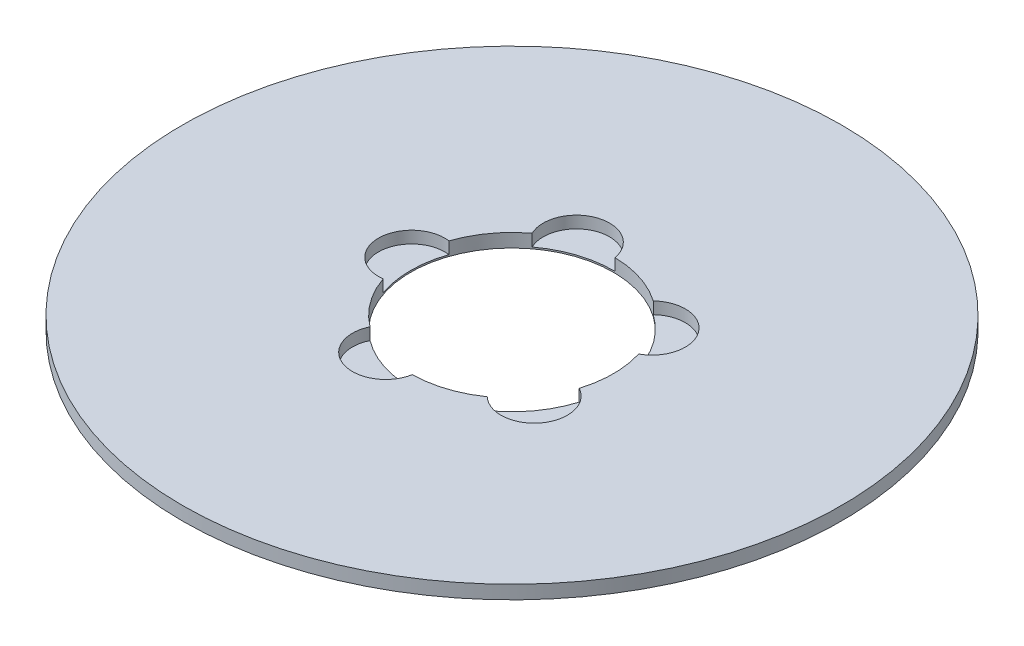
from build123d import *

# Parameters (mm, degrees)
SKETCH1_R           = 97.5
BOSS_EXTRUDE1_DEPTH = 4
SKETCH2_R           = 30
CUT_EXTRUDE1_DEPTH  = 138.943829148
SKETCH3_R           = 9.823399276
CUT_EXTRUDE2_DEPTH  = 3.531855197
CIRPATTERN1_COUNT   = 5


with BuildPart() as part:
    # Sketch1 → Boss-Extrude1 (new body)
    with BuildSketch(Plane(origin=(0, 0, 0), x_dir=(1, 0, 0), z_dir=(0, 1, 0))):
        Circle(SKETCH1_R)
    extrude(amount=BOSS_EXTRUDE1_DEPTH)

    # Sketch2 → Cut-Extrude1 (cut, through all)
    with BuildSketch(Plane(origin=(0, 0, 0), x_dir=(1, 0, 0), z_dir=(0, 1, 0))):
        Circle(SKETCH2_R)
    extrude(amount=CUT_EXTRUDE1_DEPTH, mode=Mode.SUBTRACT)

    # Sketch3 → Cut-Extrude2 (cut)
    with BuildSketch(Plane(origin=(0, 4, 0), x_dir=(1, 0, 0), z_dir=(0, 1, 0))):
        with Locations((-29.675737108, 0)):
            Circle(SKETCH3_R)
    cut_extrude2 = extrude(amount=-CUT_EXTRUDE2_DEPTH, mode=Mode.SUBTRACT)

    # CirPattern1: Cut-Extrude2 ×5 about axis
    cirpattern1_axis = Axis((0, 0, 0), (0, 1, 0))
    for i in range(1, CIRPATTERN1_COUNT):
        add(cut_extrude2.rotate(cirpattern1_axis, i * 360 / CIRPATTERN1_COUNT), mode=Mode.SUBTRACT)


solid = part.part
